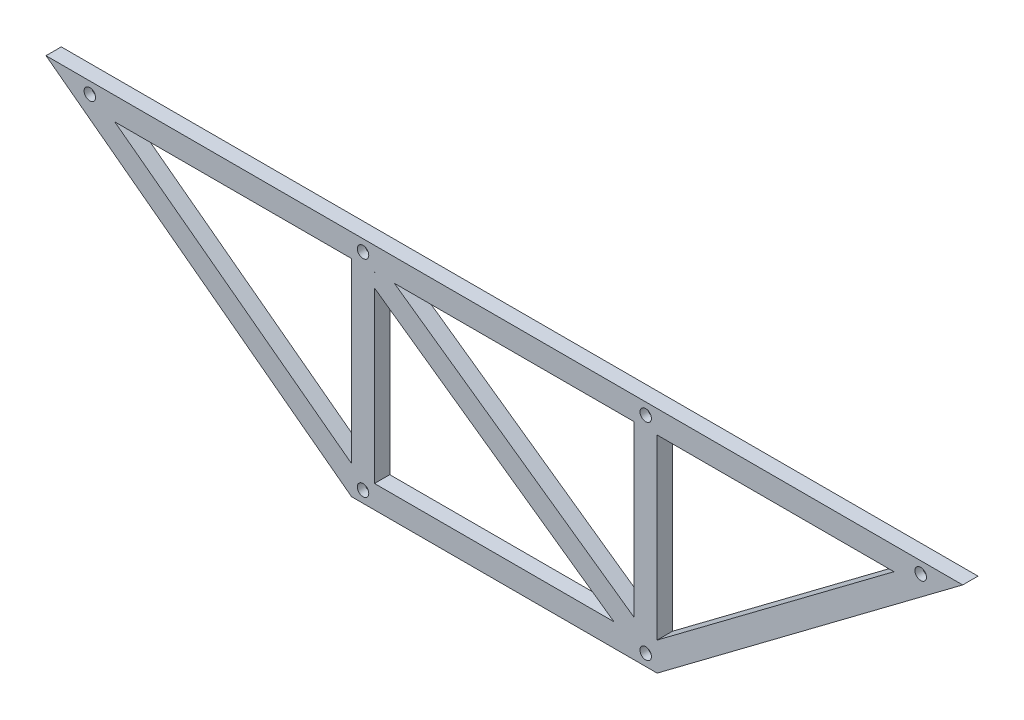
from build123d import *

# Parameters (mm, degrees)
BOSS_EXTRUDE1_DEPTH = 20
CUT_EXTRUDE1_DEPTH  = 20
BOSS_EXTRUDE3_DEPTH = 20
SKETCH6_R           = 7.5
CUT_EXTRUDE3_DEPTH  = 10
SHELL2_START        = 5
SHELL2_DEPTH        = 10


# Read off the part's stored shape, not the designer's step: Shell2
with BuildPart() as part:
    # Sketch2 → Boss-Extrude1 (new body)
    with BuildSketch(Plane.XY):
        Polygon((-219.402985075, 0), (-619.402985075, 300), (580.597014925, 300), (180.597014925, 0), align=None)
    extrude(amount=BOSS_EXTRUDE1_DEPTH)

    # Sketch3 → Cut-Extrude1 (cut)
    with BuildSketch(Plane.XY.offset(20)):
        Polygon((-529.402985075, 270), (-209.402985075, 30), (170.597014925, 30), (490.597014925, 270), align=None)
    extrude(amount=-CUT_EXTRUDE1_DEPTH, mode=Mode.SUBTRACT)

    # Sketch4 → Boss-Extrude3 (add)
    with BuildSketch(Plane.XY.offset(20)):
        Polygon((-219.402985075, 270), (-219.402985075, 37.5), (-219.402985075, 30), (-189.402985075, 30), (-189.402985075, 251.618524964), (-197.626477217, 257.431891774), (-189.402985075, 269.064707185), (-189.402985075, 270), align=None)
        Polygon((-180.308988395, 281.928923858), (-189.402985075, 269.064707185), (-189.402985075, 251.618524964), (141.766056114, 17.507872327), (150.597014925, 30), (150.597014925, 48.004218454), align=None)
        Polygon((-189.402985075, 251.618524964), (-189.402985075, 269.064707185), (-197.626477217, 257.431891774), align=None)
        Polygon((158.892990534, 42.497071205), (150.597014925, 48.004218454), (150.597014925, 30), align=None)
        Polygon((150.597014925, 270), (150.597014925, 48.004218454), (158.892990534, 42.497071205), (150.597014925, 30), (180.597014925, 30), (180.597014925, 37.5), (180.597014925, 270), align=None)
    extrude(amount=-BOSS_EXTRUDE3_DEPTH)

    # Sketch6 → Cut-Extrude3 (cut)
    with BuildSketch(Plane.XY.offset(20)):
        with Locations((-204.402985075, 285)):
            Circle(SKETCH6_R)
        with Locations((-204.402985075, 15)):
            Circle(SKETCH6_R)
        with Locations((165.597014925, 15)):
            Circle(SKETCH6_R)
        with Locations((165.597014925, 285)):
            Circle(SKETCH6_R)
        with Locations((525.597014925, 285)):
            Circle(SKETCH6_R)
        with Locations((-562.046220464, 285)):
            Circle(SKETCH6_R)
    extrude(amount=-CUT_EXTRUDE3_DEPTH, mode=Mode.SUBTRACT)

    # Shell2 outline → Shell2 (cut)
    with BuildSketch(Plane.XY.offset(SHELL2_START)):
        with BuildLine():
            ThreePointArc((-554.546220464, 295), (-562.046220464, 272.5), (-569.546220464, 295))
            Line((-569.546220464, 295), (-604.402985075, 295))
            Line((-604.402985075, 295), (-217.736318408, 5))
            Line((-217.736318408, 5), (-211.902985075, 5))
            ThreePointArc((-211.902985075, 5), (-204.402985075, 27.5), (-196.902985075, 5))
            Line((-196.902985075, 5), (158.097014925, 5))
            ThreePointArc((158.097014925, 5), (165.597014925, 27.5), (173.097014925, 5))
            Line((173.097014925, 5), (178.930348259, 5))
            Line((178.930348259, 5), (565.597014925, 295))
            Line((565.597014925, 295), (533.097014925, 295))
            ThreePointArc((533.097014925, 295), (525.597014925, 272.5), (518.097014925, 295))
            Line((518.097014925, 295), (173.097014925, 295))
            ThreePointArc((173.097014925, 295), (165.597014925, 272.5), (158.097014925, 295))
            Line((158.097014925, 295), (-196.902985075, 295))
            ThreePointArc((-196.902985075, 295), (-204.402985075, 272.5), (-211.902985075, 295))
            Line((-211.902985075, 295), (-554.546220464, 295))
        make_face()
        Polygon((-544.402985075, 275), (-214.402985075, 275), (-214.402985075, 27.5), align=None, mode=Mode.SUBTRACT)
        Polygon((-194.402985075, 275), (155.597014925, 275), (155.597014925, 38.346418141), (-179.112397852, 274.95983704), (-190.657390399, 258.628482317), (139.829580663, 25), (-194.402985075, 25), align=None, mode=Mode.SUBTRACT)
        Polygon((175.597014925, 275), (505.597014925, 275), (175.597014925, 27.5), align=None, mode=Mode.SUBTRACT)
    extrude(amount=SHELL2_DEPTH, mode=Mode.SUBTRACT)


solid = part.part
